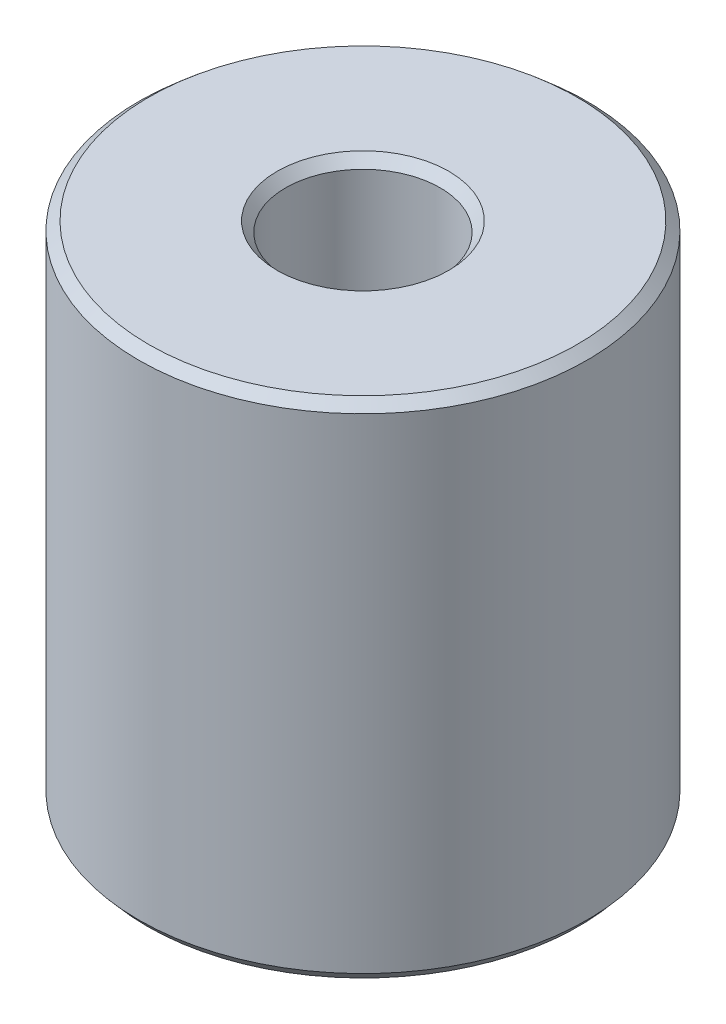
from build123d import *
from OCP.BRepFilletAPI import BRepFilletAPI_MakeChamfer

# Parameters (mm, degrees)
SKETCH1_R           = 7.5
BOSS_EXTRUDE1_DEPTH = 16.840204435
SKETCH2_R           = 2.584343789
CUT_EXTRUDE1_DEPTH  = 20.90207239
CHAMFER1_SIZE       = 0.288531789
CHAMFER1_SIZE2      = 0.332812918


with BuildPart() as part:
    # Sketch1 → Boss-Extrude1 (new body)
    with BuildSketch(Plane(origin=(0, 0, 0), x_dir=(1, 0, 0), z_dir=(0, 1, 0))):
        Circle(SKETCH1_R)
    extrude(amount=BOSS_EXTRUDE1_DEPTH)

    # Sketch2 → Cut-Extrude1 (cut, through all)
    with BuildSketch(Plane(origin=(0, 0, 0), x_dir=(1, 0, 0), z_dir=(0, 1, 0))):
        Circle(SKETCH2_R)
    extrude(amount=CUT_EXTRUDE1_DEPTH, mode=Mode.SUBTRACT)

    # Chamfer1: one chamfer whose edges measure the first distance from different faces: ONE call of the kernel's chamfer builder (chamfer() names one face for all edges)
    chamfer1_edges_1 = [part.edges().sort_by_distance(p)[0] for p in [
        (-2.584343789, 16.840204435, 0),
    ]]
    chamfer1_side_1 = [part.faces().sort_by_distance(p)[0] for p in [
        (-7.287867966, 16.840204435, 0),
    ]]
    chamfer1_edges_2 = [part.edges().sort_by_distance(p)[0] for p in [
        (-2.584343789, 0, 0),
    ]]
    chamfer1_side_2 = [part.faces().sort_by_distance(p)[0] for p in [
        (-2.584343789, 8.420102218, 0),
    ]]
    chamfer1_edges_3 = [part.edges().sort_by_distance(p)[0] for p in [
        (-7.5, 0, 0),
    ]]
    chamfer1_side_3 = [part.faces().sort_by_distance(p)[0] for p in [
        (-7.287867966, 0, 0),
    ]]
    chamfer1_edges_4 = [part.edges().sort_by_distance(p)[0] for p in [
        (-7.5, 16.840204435, 0),
    ]]
    chamfer1_side_4 = [part.faces().sort_by_distance(p)[0] for p in [
        (-7.5, 8.420102218, 0),
    ]]
    chamfer1 = BRepFilletAPI_MakeChamfer(part.part.solid().wrapped)
    for e in chamfer1_edges_1:
        chamfer1.Add(CHAMFER1_SIZE, CHAMFER1_SIZE2, e.wrapped, chamfer1_side_1[0].wrapped)  # the first distance lies on this face
    for e in chamfer1_edges_2:
        chamfer1.Add(CHAMFER1_SIZE, CHAMFER1_SIZE2, e.wrapped, chamfer1_side_2[0].wrapped)  # the first distance lies on this face
    for e in chamfer1_edges_3:
        chamfer1.Add(CHAMFER1_SIZE, CHAMFER1_SIZE2, e.wrapped, chamfer1_side_3[0].wrapped)  # the first distance lies on this face
    for e in chamfer1_edges_4:
        chamfer1.Add(CHAMFER1_SIZE, CHAMFER1_SIZE2, e.wrapped, chamfer1_side_4[0].wrapped)  # the first distance lies on this face
    add(Compound.cast(chamfer1.Shape()), mode=Mode.REPLACE)


solid = part.part
